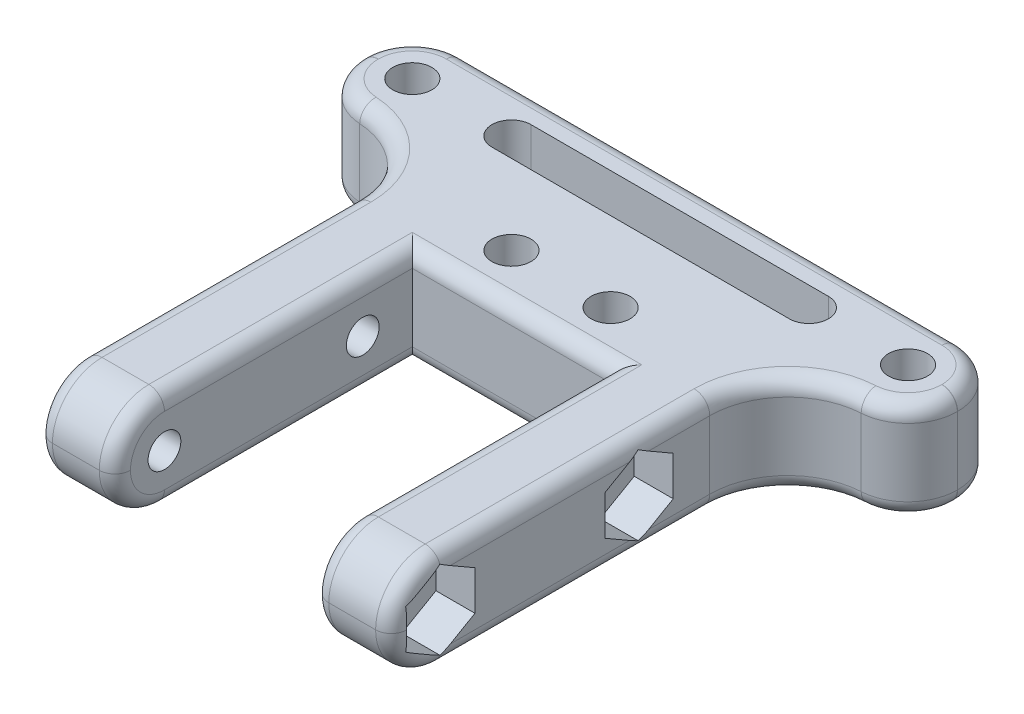
from build123d import *

# Parameters (mm, degrees)
SKETCH1_R               = 2.5
BOSS_EXTRUDE2_DEPTH     = 12.7
FILLET1_R               = 6.35
FILLET2_R               = 6.35
FILLET3_R               = 2
CUT_EXTRUDE1_REACH      = 86.404
SKETCH2_R               = 2.1
CUT_EXTRUDE4_DEPTH      = 12.7
CUT_EXTRUDE4_DEPTH_BACK = 5
FILLET4_R               = 2


with BuildPart() as part:
    # Sketch1 → Boss-Extrude2 (new body)
    with BuildSketch(Plane(origin=(0, 0, 0), x_dir=(1, 0, 0), z_dir=(0, 1, 0))):
        with BuildLine():
            Line((-6.35, 6.35), (69.85, 6.35))
            Line((69.85, 6.35), (69.85, -6.35))
            Line((69.85, -6.35), (64.45, -6.35))
            ThreePointArc((64.45, -6.35), (57.378932188, -9.278932188), (54.45, -16.35))
            Line((54.45, -16.35), (54.45, -57.15))
            Line((54.45, -57.15), (44.45, -57.15))
            Line((44.45, -57.15), (44.45, -19.05))
            Line((44.45, -19.05), (19.05, -19.05))
            Line((19.05, -19.05), (19.05, -57.15))
            Line((19.05, -57.15), (9.05, -57.15))
            Line((9.05, -57.15), (9.05, -16.35))
            ThreePointArc((9.05, -16.35), (6.121067812, -9.278932188), (-0.95, -6.35))
            Line((-0.95, -6.35), (-6.35, -6.35))
            Line((-6.35, -6.35), (-6.35, 6.35))
        make_face()
        with Locations(Location((0, 0, 0), (0, 0, 270))):
            Circle(SKETCH1_R, mode=Mode.SUBTRACT)
        with Locations(Location((63.5, 0, 0), (0, 0, 270))):
            Circle(SKETCH1_R, mode=Mode.SUBTRACT)
        with Locations(Location((38.1, -12.7, 0), (0, 0, 270))):
            Circle(SKETCH1_R, mode=Mode.SUBTRACT)
        with Locations(Location((25.4, -12.7, 0), (0, 0, 270))):
            Circle(SKETCH1_R, mode=Mode.SUBTRACT)
        with BuildLine():
            Line((12.7, 2.5), (50.8, 2.5))
            ThreePointArc((50.8, 2.5), (53.3, 0), (50.8, -2.5))
            Line((50.8, -2.5), (12.7, -2.5))
            ThreePointArc((12.7, -2.5), (10.2, 0), (12.7, 2.5))
        make_face(mode=Mode.SUBTRACT)
    extrude(amount=BOSS_EXTRUDE2_DEPTH)

    # Fillet1
    fillet1_edges = [part.edges().sort_by_distance(p)[0] for p in [
        (49.45, 0, 57.15),
        (49.45, 12.7, 57.15),
        (14.05, 0, 57.15),
        (14.05, 12.7, 57.15),
    ]]
    fillet(fillet1_edges, radius=FILLET1_R - 0.0001)  # a hair under: the kernel refuses the full size

    # Fillet2
    fillet2_edges = [part.edges().sort_by_distance(p)[0] for p in [
        (69.85, 6.35, 6.35),
        (69.85, 6.35, -6.35),
        (-6.35, 6.35, -6.35),
        (-6.35, 6.35, 6.35),
    ]]
    fillet(fillet2_edges, radius=FILLET2_R)

    # Fillet3
    fillet3_edges = [part.edges().sort_by_distance(p)[0] for p in [
        (9.05, 0, 33.57505),
        (57.176404, 0, 9.487434793),
        (9.05, 12.7, 33.57505),
        (57.176404, 12.7, 9.487434793),
        (54.45, 0, 33.57505),
        (54.45, 12.7, 33.57505),
        (54.45, 10.84015735, 55.29015735),
        (54.45, 1.85984265, 55.29015735),
        (9.05, 10.84015735, 55.29015735),
        (9.05, 1.85984265, 55.29015735),
        (69.85, 0, 0.013811361),
        (69.85, 12.7, 0.013811361),
        (6.323596, 0, 9.487434793),
        (-6.35, 0, 0.013811361),
        (31.75, 0, -6.35),
        (-4.61873346, 0, 4.385351629),
        (-4.490128061, 0, -4.490128061),
        (67.990128061, 0, -4.490128061),
        (68.11873346, 0, 4.385351629),
        (31.75, 12.7, -6.35),
        (-6.35, 12.7, 0.013811361),
        (6.323596, 12.7, 9.487434793),
        (-4.61873346, 12.7, 4.385351629),
        (-4.490128061, 12.7, -4.490128061),
        (67.990128061, 12.7, -4.490128061),
        (68.11873346, 12.7, 4.385351629),
    ]]
    fillet(fillet3_edges, radius=FILLET3_R)

    # Cut-Extrude1: up to this face of the body (flat: up to its plane)
    cut_extrude1_end = Plane(part.part.faces().sort_by_distance((54.45, 6.35, 35.29570889))[0])
    # Sketch2 → Cut-Extrude1 (cut, up to the picked face)
    with BuildSketch(Plane.ZY.offset(-9.05), mode=Mode.PRIVATE) as cut_extrude1_sk1:
        with Locations((50.8, 6.35)):
            Circle(SKETCH2_R)
    cut_extrude1_tool1 = split(extrude(cut_extrude1_sk1.sketch, amount=-CUT_EXTRUDE1_REACH, mode=Mode.PRIVATE), bisect_by=cut_extrude1_end, keep=Keep.BOTH, mode=Mode.PRIVATE)
    # Sketch2 → Cut-Extrude1 (cut, up to the picked face)
    with BuildSketch(Plane.ZY.offset(-9.05), mode=Mode.PRIVATE) as cut_extrude1_sk2:
        with Locations((25.4, 6.35)):
            Circle(SKETCH2_R)
    cut_extrude1_tool2 = split(extrude(cut_extrude1_sk2.sketch, amount=-CUT_EXTRUDE1_REACH, mode=Mode.PRIVATE), bisect_by=cut_extrude1_end, keep=Keep.BOTH, mode=Mode.PRIVATE)
    add(cut_extrude1_tool1.solids().sort_by(Axis((9.05, 6.35, 50.8), (1, 0, 0)))[0], mode=Mode.SUBTRACT)
    add(cut_extrude1_tool2.solids().sort_by(Axis((9.05, 6.35, 25.4), (1, 0, 0)))[0], mode=Mode.SUBTRACT)

    # Sketch3 → Cut-Extrude4 (cut, two sides: drawn at the far end of the back side and taken through both)
    with BuildSketch(Plane(origin=(54.45, 0, 0), x_dir=(0, 0, -1), z_dir=(1, 0, 0)).offset(-CUT_EXTRUDE4_DEPTH_BACK)):
        Polygon((-25.4, 1.298185145), (-21.025, 3.824092572), (-21.025, 8.875907428), (-25.4, 11.401814855), (-29.775, 8.875907428), (-29.775, 3.824092572), align=None)
        Polygon((-50.8, 1.298185145), (-46.425, 3.824092572), (-46.425, 8.875907428), (-50.8, 11.401814855), (-55.175, 8.875907428), (-55.175, 3.824092572), align=None)
    extrude(amount=CUT_EXTRUDE4_DEPTH + CUT_EXTRUDE4_DEPTH_BACK, mode=Mode.SUBTRACT)

    # Fillet4
    fillet4_edges = [part.edges().sort_by_distance(p)[0] for p in [
        (44.45, 0, 34.92505),
        (31.75, 0, 19.05),
        (31.75, 12.7, 19.05),
        (44.45, 12.7, 34.92505),
        (19.05, 0, 34.92505),
        (44.45, 10.84015735, 55.29015735),
        (44.45, 1.85984265, 55.29015735),
        (19.05, 12.7, 34.92505),
        (19.05, 10.84015735, 55.29015735),
        (19.05, 1.85984265, 55.29015735),
    ]]
    fillet(fillet4_edges, radius=FILLET4_R)


solid = part.part
